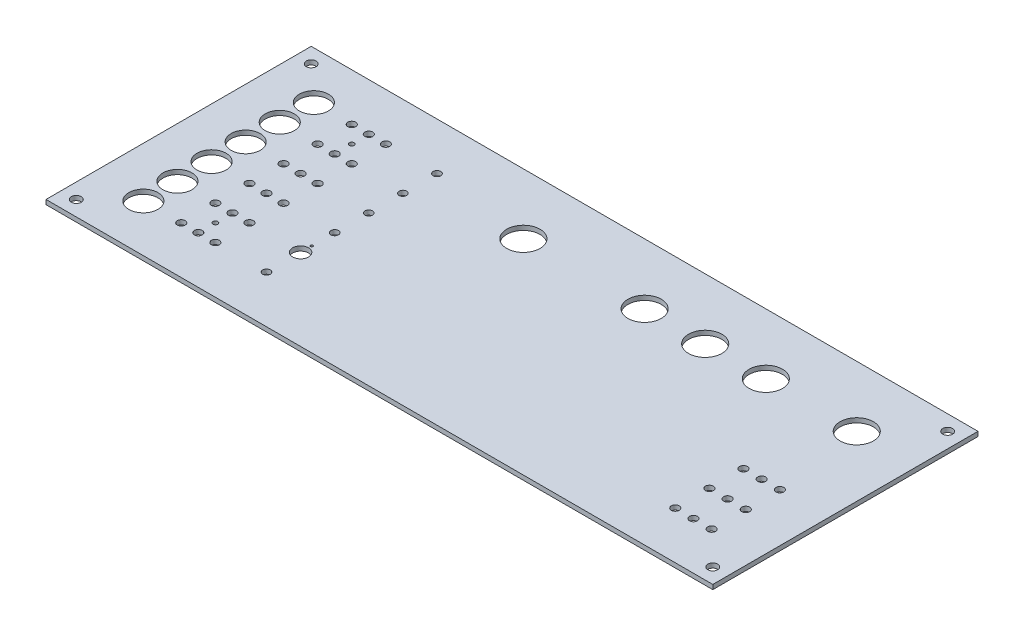
from build123d import *

# Parameters (mm, degrees)
SKETCH1_W           = 440
SKETCH1_H           = 175
SKETCH1_R           = 3.25
SKETCH1_R_2         = 9.6
SKETCH1_R_3         = 2.6
SKETCH1_R_4         = 11
SKETCH1_R_5         = 2.5
SKETCH1_R_6         = 5.25
SKETCH1_R_7         = 0.8
SKETCH1_R_8         = 1.6
BOSS_EXTRUDE1_DEPTH = 3


with BuildPart() as part:
    # Sketch1 → Boss-Extrude1 (new body)
    with BuildSketch(Plane(origin=(0, 0, 0), x_dir=(1, 0, 0), z_dir=(0, 1, 0))):
        with Locations((220, 87.5)):
            Rectangle(SKETCH1_W, SKETCH1_H)
        with Locations((10, 10)):
            Circle(SKETCH1_R, mode=Mode.SUBTRACT)
        with Locations((10, 165)):
            Circle(SKETCH1_R, mode=Mode.SUBTRACT)
        with Locations((430, 165)):
            Circle(SKETCH1_R, mode=Mode.SUBTRACT)
        with Locations((430, 10)):
            Circle(SKETCH1_R, mode=Mode.SUBTRACT)
        with Locations((33, 31.25)):
            Circle(SKETCH1_R_2, mode=Mode.SUBTRACT)
        with Locations((33, 53.75)):
            Circle(SKETCH1_R_2, mode=Mode.SUBTRACT)
        with Locations((33, 76.25)):
            Circle(SKETCH1_R_2, mode=Mode.SUBTRACT)
        with Locations((33, 98.75)):
            Circle(SKETCH1_R_2, mode=Mode.SUBTRACT)
        with Locations((33, 121.25)):
            Circle(SKETCH1_R_2, mode=Mode.SUBTRACT)
        with Locations((33, 143.75)):
            Circle(SKETCH1_R_2, mode=Mode.SUBTRACT)
        with Locations((58, 31.25)):
            Circle(SKETCH1_R_3, mode=Mode.SUBTRACT)
        with Locations((58, 53.75)):
            Circle(SKETCH1_R_3, mode=Mode.SUBTRACT)
        with Locations((58, 76.25)):
            Circle(SKETCH1_R_3, mode=Mode.SUBTRACT)
        with Locations((58, 98.75)):
            Circle(SKETCH1_R_3, mode=Mode.SUBTRACT)
        with Locations((58, 121.25)):
            Circle(SKETCH1_R_3, mode=Mode.SUBTRACT)
        with Locations((58, 143.75)):
            Circle(SKETCH1_R_3, mode=Mode.SUBTRACT)
        with Locations((69.25, 31.25)):
            Circle(SKETCH1_R_3, mode=Mode.SUBTRACT)
        with Locations((69.25, 53.75)):
            Circle(SKETCH1_R_3, mode=Mode.SUBTRACT)
        with Locations((69.25, 76.25)):
            Circle(SKETCH1_R_3, mode=Mode.SUBTRACT)
        with Locations((69.25, 98.75)):
            Circle(SKETCH1_R_3, mode=Mode.SUBTRACT)
        with Locations((69.25, 121.25)):
            Circle(SKETCH1_R_3, mode=Mode.SUBTRACT)
        with Locations((69.25, 143.75)):
            Circle(SKETCH1_R_3, mode=Mode.SUBTRACT)
        with Locations((80.5, 31.25)):
            Circle(SKETCH1_R_3, mode=Mode.SUBTRACT)
        with Locations((80.5, 53.75)):
            Circle(SKETCH1_R_3, mode=Mode.SUBTRACT)
        with Locations((80.5, 76.25)):
            Circle(SKETCH1_R_3, mode=Mode.SUBTRACT)
        with Locations((80.5, 98.75)):
            Circle(SKETCH1_R_3, mode=Mode.SUBTRACT)
        with Locations((80.5, 121.25)):
            Circle(SKETCH1_R_3, mode=Mode.SUBTRACT)
        with Locations((80.5, 143.75)):
            Circle(SKETCH1_R_3, mode=Mode.SUBTRACT)
        with Locations((400, 135)):
            Circle(SKETCH1_R_4, mode=Mode.SUBTRACT)
        with Locations((340, 135)):
            Circle(SKETCH1_R_4, mode=Mode.SUBTRACT)
        with Locations((300, 135)):
            Circle(SKETCH1_R_4, mode=Mode.SUBTRACT)
        with Locations((260, 135)):
            Circle(SKETCH1_R_4, mode=Mode.SUBTRACT)
        with Locations((180, 135)):
            Circle(SKETCH1_R_4, mode=Mode.SUBTRACT)
        with Locations((408, 31.25)):
            Circle(SKETCH1_R_3, mode=Mode.SUBTRACT)
        with Locations((396, 31.25)):
            Circle(SKETCH1_R_3, mode=Mode.SUBTRACT)
        with Locations((384, 31.25)):
            Circle(SKETCH1_R_3, mode=Mode.SUBTRACT)
        with Locations((408, 53.75)):
            Circle(SKETCH1_R_3, mode=Mode.SUBTRACT)
        with Locations((396, 53.75)):
            Circle(SKETCH1_R_3, mode=Mode.SUBTRACT)
        with Locations((384, 53.75)):
            Circle(SKETCH1_R_3, mode=Mode.SUBTRACT)
        with Locations((408, 76.25)):
            Circle(SKETCH1_R_3, mode=Mode.SUBTRACT)
        with Locations((396, 76.25)):
            Circle(SKETCH1_R_3, mode=Mode.SUBTRACT)
        with Locations((384, 76.25)):
            Circle(SKETCH1_R_3, mode=Mode.SUBTRACT)
        with Locations((114.25, 143.75)):
            Circle(SKETCH1_R_5, mode=Mode.SUBTRACT)
        with Locations((114.25, 121.25)):
            Circle(SKETCH1_R_5, mode=Mode.SUBTRACT)
        with Locations((114.25, 98.75)):
            Circle(SKETCH1_R_5, mode=Mode.SUBTRACT)
        with Locations((114.25, 76.25)):
            Circle(SKETCH1_R_5, mode=Mode.SUBTRACT)
        with Locations((114.25, 53.75)):
            Circle(SKETCH1_R_6, mode=Mode.SUBTRACT)
        with Locations((114.25, 31.25)):
            Circle(SKETCH1_R_5, mode=Mode.SUBTRACT)
        with Locations((114.25, 61.17)):
            Circle(SKETCH1_R_7, mode=Mode.SUBTRACT)
        with Locations((69.25, 132.5)):
            Circle(SKETCH1_R_8, mode=Mode.SUBTRACT)
        with Locations((69.25, 42.5)):
            Circle(SKETCH1_R_8, mode=Mode.SUBTRACT)
    extrude(amount=BOSS_EXTRUDE1_DEPTH)


solid = part.part
